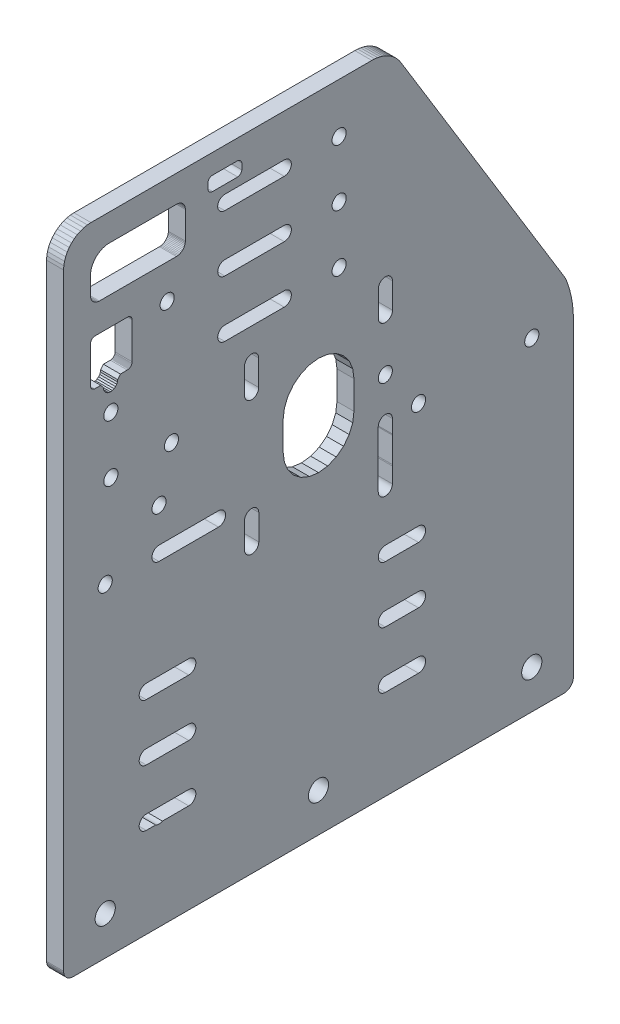
from build123d import *

# Parameters (mm, degrees)
SKETCH1_R           = 3.5685
SKETCH1_R_2         = 2.500000001
SKETCH1_R_3         = 2.5
BOSS_EXTRUDE1_DEPTH = 6
SKETCH2_R           = 2.500000001
SKETCH2_R_2         = 2.5
CUT_EXTRUDE3_DEPTH  = 1779.046328539


with BuildPart() as part:
    # Sketch1 → Boss-Extrude1 (new body)
    with BuildSketch(Plane(origin=(0, 0, 0), x_dir=(0, -1, 0), z_dir=(-1, 0, 0))):
        Polygon((-590.212112636, -1614.243728334), (-495.230350852, -1672.335619946), (-492.985489602, -1673.198794727), (-490.688058814, -1673.910331453), (-488.34828871, -1674.467061724), (-485.976598042, -1674.866506478), (-483.583547703, -1675.10688703), (-481.179793697, -1675.18713299), (-371.826596113, -1675.18713299), (-371.387664827, -1675.158363913), (-370.956243777, -1675.072548931), (-370.539714696, -1674.931156361), (-370.145204514, -1674.736605469), (-369.779463407, -1674.492225074), (-369.448749309, -1674.202196594), (-369.158720829, -1673.871482496), (-368.914340435, -1673.50574139), (-368.719789543, -1673.111231207), (-368.578396973, -1672.694702127), (-368.49258199, -1672.263281077), (-368.463812914, -1671.82434979), (-368.463812914, -1498.50991619), (-368.49258199, -1498.070984903), (-368.578396973, -1497.639563853), (-368.719789543, -1497.223034773), (-368.914340435, -1496.82852459), (-369.158720829, -1496.462783484), (-369.448749309, -1496.132069386), (-369.779463407, -1495.842040906), (-370.145204514, -1495.597660511), (-370.539714696, -1495.403109619), (-370.956243777, -1495.261717049), (-371.387664827, -1495.175902067), (-371.826596113, -1495.14713299), (-586.288106544, -1495.145619765), (-587.549717355, -1495.228301598), (-588.789742622, -1495.474950056), (-589.98696498, -1495.881344878), (-591.12089944, -1496.440532473), (-592.172143895, -1497.142944902), (-593.122711102, -1497.976563587), (-593.956336446, -1498.927124952), (-594.658756242, -1499.978364486), (-595.217951782, -1501.112295027), (-595.624354993, -1502.309514537), (-595.87101214, -1503.549538076), (-595.953702813, -1504.811148308), (-595.953702813, -1603.994310614), (-595.910202971, -1605.015955139), (-595.780018321, -1606.030204482), (-595.564091204, -1607.029716989), (-595.263984611, -1608.007257681), (-594.881870865, -1608.955750621), (-594.420515902, -1609.868330136), (-593.883259242, -1610.738390509), (-593.273989822, -1611.559633802), (-592.597117845, -1612.326115438), (-591.857542854, -1613.032287234), (-591.060618269, -1613.673037558), align=None)
        with Locations((-382.159118976, -1509.84713299)):
            Circle(SKETCH1_R, mode=Mode.SUBTRACT)
        with Locations((-382.159118976, -1585.16713299)):
            Circle(SKETCH1_R, mode=Mode.SUBTRACT)
        with Locations((-382.159118976, -1660.48713299)):
            Circle(SKETCH1_R, mode=Mode.SUBTRACT)
        with Locations((-538.399280751, -1592.457817223)):
            Circle(SKETCH1_R_2, mode=Mode.SUBTRACT)
        with Locations((-558.44846865, -1592.457817223)):
            Circle(SKETCH1_R_2, mode=Mode.SUBTRACT)
        with Locations((-578.44846865, -1592.457817223)):
            Circle(SKETCH1_R_2, mode=Mode.SUBTRACT)
        with Locations((-534.443559506, -1511.847133017)):
            Circle(SKETCH1_R_2, mode=Mode.SUBTRACT)
        with Locations((-558.402442437, -1531.722977175)):
            Circle(SKETCH1_R_2, mode=Mode.SUBTRACT)
        with Locations((-514.443559639, -1511.847132679)):
            Circle(SKETCH1_R_2, mode=Mode.SUBTRACT)
        with Locations((-514.443559639, -1533.238984755)):
            Circle(SKETCH1_R_2, mode=Mode.SUBTRACT)
        with Locations((-497.496167838, -1528.847132988)):
            Circle(SKETCH1_R_3, mode=Mode.SUBTRACT)
        with Locations((-482.799118976, -1549.84713299)):
            Circle(SKETCH1_R_2, mode=Mode.SUBTRACT)
        with Locations((-482.799118976, -1509.84713299)):
            Circle(SKETCH1_R_2, mode=Mode.SUBTRACT)
        with Locations((-482.799118976, -1620.48713299)):
            Circle(SKETCH1_R_2, mode=Mode.SUBTRACT)
        with Locations((-482.799118977, -1660.487132991)):
            Circle(SKETCH1_R_2, mode=Mode.SUBTRACT)
        with Locations((-402.49616799, -1528.847132989)):
            Circle(SKETCH1_R_2, mode=Mode.SUBTRACT)
        with BuildLine():
            Line((-575.977758464, -1552.084054241), (-575.977758464, -1573.056806032))
            ThreePointArc((-575.977758464, -1573.056806032), (-578.457148005, -1575.577342323), (-580.977684295, -1573.097952782))
            Line((-580.977684295, -1573.097952782), (-580.977684295, -1552.084054231))
            ThreePointArc((-580.977684295, -1552.084054231), (-578.477721375, -1549.570437307), (-575.977758464, -1552.084054241))
        make_face(mode=Mode.SUBTRACT)
        with BuildLine():
            Line((-535.977790671, -1552.085412401), (-535.977790671, -1573.058164192))
            ThreePointArc((-535.977790671, -1573.058164192), (-538.457180211, -1575.578700483), (-540.977716502, -1573.099310942))
            Line((-540.977716502, -1573.099310942), (-540.977716502, -1552.085412391))
            ThreePointArc((-540.977716502, -1552.085412391), (-538.477753581, -1549.571795467), (-535.977790671, -1552.085412401))
        make_face(mode=Mode.SUBTRACT)
        with BuildLine():
            Line((-555.97770846, -1552.099177314), (-555.97770846, -1573.085546029))
            ThreePointArc((-555.97770846, -1573.085546029), (-558.463906443, -1575.599273877), (-560.977634291, -1573.113075895))
            Line((-560.977634291, -1573.113075895), (-560.977634291, -1552.099177304))
            ThreePointArc((-560.977634291, -1552.099177304), (-558.47767137, -1549.58556036), (-555.97770846, -1552.099177314))
        make_face(mode=Mode.SUBTRACT)
        with BuildLine():
            Line((-524.913709892, -1559.055192962), (-515.913733671, -1559.055192962))
            ThreePointArc((-515.913733671, -1559.055192962), (-513.413733671, -1561.555192962), (-515.913733671, -1564.055192962))
            Line((-515.913733671, -1564.055192962), (-524.913709892, -1564.055192962))
            ThreePointArc((-524.913709892, -1564.055192962), (-527.413709892, -1561.555192962), (-524.913709892, -1559.055192962))
        make_face(mode=Mode.SUBTRACT)
        with BuildLine():
            Line((-524.913709892, -1606.299062763), (-515.913733671, -1606.299062763))
            ThreePointArc((-515.913733671, -1606.299062763), (-513.413733671, -1608.799062763), (-515.913733671, -1611.299062763))
            Line((-515.913733671, -1611.299062763), (-524.913709892, -1611.299062763))
            ThreePointArc((-524.913709892, -1611.299062763), (-527.413709892, -1608.799062763), (-524.913709892, -1606.299062763))
        make_face(mode=Mode.SUBTRACT)
        with BuildLine():
            Line((-477.66984009, -1606.299062763), (-468.669863869, -1606.299062763))
            ThreePointArc((-468.669863869, -1606.299062763), (-466.169863869, -1608.799062763), (-468.669863869, -1611.299062763))
            Line((-468.669863869, -1611.299062763), (-477.66984009, -1611.299062763))
            ThreePointArc((-477.66984009, -1611.299062763), (-480.16984009, -1608.799062763), (-477.66984009, -1606.299062763))
        make_face(mode=Mode.SUBTRACT)
        with BuildLine():
            Line((-477.669839463, -1559.052819647), (-468.669863869, -1559.055192962))
            ThreePointArc((-468.669863869, -1559.055192962), (-466.159015015, -1561.567366398), (-468.671188452, -1564.078215252))
            Line((-468.671188452, -1564.078215252), (-477.669845536, -1564.075842286))
            ThreePointArc((-477.669845536, -1564.075842286), (-480.18069465, -1561.564327931), (-477.669839463, -1559.052819647))
        make_face(mode=Mode.SUBTRACT)
        Polygon((-586.033555203, -1536.579108211), (-586.214987166, -1536.211200586), (-586.346845371, -1535.822758839), (-586.426873689, -1535.420429315), (-586.453702813, -1535.011095984), (-586.453702813, -1511.296236305), (-586.396818705, -1510.428352529), (-586.227139684, -1509.575318486), (-585.947569005, -1508.751729823), (-585.5628902, -1507.971678372), (-585.079685229, -1507.248511028), (-584.506221865, -1506.594601387), (-583.852312223, -1506.021138022), (-583.12914488, -1505.537933052), (-582.349093428, -1505.153254247), (-581.525504766, -1504.873683568), (-580.672470722, -1504.704004546), (-579.804586946, -1504.647120438), (-573.616888973, -1504.647120438), (-573.207555642, -1504.673949562), (-572.805226118, -1504.75397788), (-572.416784371, -1504.885836086), (-572.048876746, -1505.067268048), (-571.707798245, -1505.295169417), (-571.399384815, -1505.565640735), (-571.128913497, -1505.874054164), (-570.901012129, -1506.215132665), (-570.719580166, -1506.58304029), (-570.587721961, -1506.971482038), (-570.507693643, -1507.373811562), (-570.480864519, -1507.783144892), (-570.480864519, -1535.011095984), (-570.507693643, -1535.420429315), (-570.587721961, -1535.822758839), (-570.719580166, -1536.211200586), (-570.901012129, -1536.579108211), (-571.128913497, -1536.920186712), (-571.399384815, -1537.228600142), (-571.707798245, -1537.49907146), (-572.048876746, -1537.726972829), (-572.416784371, -1537.908404791), (-572.805226118, -1538.040262996), (-573.207555642, -1538.120291315), (-573.616888973, -1538.147120438), (-583.317678359, -1538.147120438), (-583.72701169, -1538.120291315), (-584.129341214, -1538.040262996), (-584.517782961, -1537.908404791), (-584.885690586, -1537.726972828), (-585.226769087, -1537.49907146), (-585.535182516, -1537.228600142), (-585.805653835, -1536.920186712), align=None, mode=Mode.SUBTRACT)
        Polygon((-560.539732338, -1505.878268758), (-560.469558584, -1505.671543545), (-560.373002121, -1505.475746407), (-560.251715057, -1505.294227488), (-560.107772647, -1505.130092628), (-559.943637786, -1504.986150218), (-559.762118868, -1504.864863154), (-559.56632173, -1504.768306692), (-559.359596516, -1504.698132937), (-559.131202133, -1504.647120439), (-558.927636825, -1504.641264366), (-548.4808636, -1504.645157132), (-545.881846575, -1504.645157132), (-545.667730411, -1504.687747485), (-545.461005198, -1504.757921239), (-545.26520806, -1504.854477702), (-545.083689141, -1504.975764766), (-544.919554281, -1505.119707176), (-544.775611871, -1505.283842037), (-544.654324807, -1505.465360956), (-544.557768344, -1505.661158094), (-544.48759459, -1505.867883307), (-544.445004238, -1506.081999471), (-544.441434684, -1508.267709423), (-543.221041992, -1509.237688263), (-542.573960137, -1509.322613597), (-541.970907354, -1509.572122279), (-541.452980696, -1509.969210703), (-541.055476008, -1510.486817951), (-540.805482577, -1511.089669943), (-540.720037042, -1511.736683313), (-540.804962376, -1512.383765169), (-541.054471058, -1512.986817951), (-541.451559482, -1513.504744609), (-541.96916673, -1513.902249297), (-542.572018722, -1514.152242729), (-543.219032092, -1514.237688263), (-544.432285676, -1515.207667102), (-544.430726027, -1517.677645941), (-544.487594599, -1518.109605632), (-544.557768353, -1518.316330846), (-544.654324816, -1518.512127983), (-544.77561188, -1518.693646902), (-544.91955429, -1518.857781763), (-545.083689151, -1519.001724172), (-545.26520807, -1519.123011236), (-545.461005208, -1519.219567699), (-545.667730421, -1519.289741453), (-546.099691027, -1519.348570172), (-558.957839921, -1519.342717258), (-559.145480362, -1519.342717258), (-559.359596526, -1519.300126905), (-559.566321739, -1519.229953151), (-559.762118877, -1519.133396688), (-559.943637796, -1519.012109624), (-560.107772656, -1518.868167214), (-560.251715066, -1518.704032353), (-560.37300213, -1518.522513435), (-560.469558592, -1518.326716297), (-560.539732347, -1518.119991083), (-560.582322699, -1517.905874919), (-560.582322699, -1517.679609247), (-560.568044472, -1506.083962777), align=None, mode=Mode.SUBTRACT)
        Polygon((-512.609294248, -1578.937135138), (-510.622811466, -1576.348300373), (-508.033976701, -1574.36181759), (-505.019214764, -1573.113062308), (-501.7839767, -1572.687135137), (-491.783976402, -1572.687135137), (-488.548738338, -1573.113062308), (-485.533976401, -1574.36181759), (-482.945141636, -1576.348300373), (-480.958658854, -1578.937135138), (-479.709903572, -1581.951897074), (-479.283976401, -1585.187135138), (-479.709903572, -1588.422373202), (-480.958658854, -1591.437135139), (-482.945141636, -1594.025969904), (-485.533976401, -1596.012452687), (-488.548738338, -1597.261207968), (-491.783976402, -1597.68713514), (-501.7839767, -1597.68713514), (-505.019214764, -1597.261207968), (-508.033976701, -1596.012452687), (-510.622811466, -1594.025969904), (-512.609294248, -1591.437135139), (-513.85804953, -1588.422373202), (-514.283976701, -1585.187135138), (-513.85804953, -1581.951897074), align=None, mode=Mode.SUBTRACT)
        with BuildLine():
            Line((-588.98086362, -1556.648178727), (-588.98086362, -1547.550419842))
            ThreePointArc((-588.98086362, -1547.550419842), (-588.50376059, -1546.590680791), (-587.544021697, -1546.113577446))
            Line((-587.544021697, -1546.113577446), (-585.643575513, -1546.099299227))
            ThreePointArc((-585.643575513, -1546.099299227), (-584.463439705, -1546.588127429), (-583.974611428, -1547.768263206))
            Line((-583.974611428, -1547.768263206), (-583.988889647, -1556.648178564))
            ThreePointArc((-583.988889647, -1556.648178564), (-584.465992569, -1557.607917612), (-585.425731394, -1558.085020984))
            Line((-585.425731394, -1558.085020984), (-587.544021696, -1558.085020984))
            ThreePointArc((-587.544021696, -1558.085020984), (-588.506313615, -1557.610470755), (-588.98086362, -1556.648178727))
        make_face(mode=Mode.SUBTRACT)
    extrude(amount=-BOSS_EXTRUDE1_DEPTH)

    # Sketch2 → Cut-Extrude3 (cut, through all)
    with BuildSketch(Plane(origin=(6, 0, 0), x_dir=(0, 0, -1), z_dir=(1, 0, 0))):
        with BuildLine():
            Line((1611.267132991, 462.799118976), (1611.267132991, 482.799118976))
            ThreePointArc((1611.267132991, 482.799118976), (1608.76713299, 485.299118977), (1606.267132989, 482.799118976))
            Line((1606.267132989, 482.799118976), (1606.267132989, 462.799118976))
            ThreePointArc((1606.267132989, 462.799118976), (1608.76713299, 460.299118975), (1611.267132991, 462.799118976))
        make_face()
        with BuildLine():
            Line((1608.76713299, 440.299118976), (1620.48713299, 440.299118976))
            ThreePointArc((1620.48713299, 440.299118976), (1622.98713299, 442.799118976), (1620.48713299, 445.299118976))
            Line((1620.48713299, 445.299118976), (1608.76713299, 445.299118976))
            ThreePointArc((1608.76713299, 445.299118976), (1606.26713299, 442.799118976), (1608.76713299, 440.299118976))
        make_face()
        with BuildLine():
            Line((1608.76713299, 420.299118976), (1620.48713299, 420.299118976))
            ThreePointArc((1620.48713299, 420.299118976), (1622.98713299, 422.799118976), (1620.48713299, 425.299118976))
            Line((1620.48713299, 425.299118976), (1608.76713299, 425.299118976))
            ThreePointArc((1608.76713299, 425.299118976), (1606.26713299, 422.799118976), (1608.76713299, 420.299118976))
        make_face()
        with BuildLine():
            Line((1608.76713299, 400.299118976), (1620.48713299, 400.299118976))
            ThreePointArc((1620.48713299, 400.299118976), (1622.98713299, 402.799118976), (1620.48713299, 405.299118976))
            Line((1620.48713299, 405.299118976), (1608.76713299, 405.299118976))
            ThreePointArc((1608.76713299, 405.299118976), (1606.26713299, 402.799118976), (1608.76713299, 400.299118976))
        make_face()
        with BuildLine():
            Line((1524.347132989, 440.299118976), (1539.347132989, 440.299118976))
            ThreePointArc((1539.347132989, 440.299118976), (1541.847132989, 442.799118976), (1539.347132989, 445.299118976))
            Line((1539.347132989, 445.299118976), (1524.347132989, 445.299118976))
            ThreePointArc((1524.347132989, 445.299118976), (1521.847132989, 442.799118976), (1524.347132989, 440.299118976))
        make_face()
        with BuildLine():
            Line((1528.847484314, 480.296167863), (1549.847484316, 480.299119001))
            ThreePointArc((1549.847484316, 480.299119001), (1552.347132966, 482.799470302), (1549.846781664, 485.299118951))
            Line((1549.846781664, 485.299118951), (1528.846781662, 485.296167813))
            ThreePointArc((1528.846781662, 485.296167813), (1526.347133012, 482.795816512), (1528.847484314, 480.296167863))
        make_face()
        with BuildLine():
            Line((1524.347274108, 420.299118976), (1539.347274108, 420.299118976))
            ThreePointArc((1539.347274108, 420.299118976), (1541.847274108, 422.799118976), (1539.347274108, 425.299118976))
            Line((1539.347274108, 425.299118976), (1524.347274108, 425.299118976))
            ThreePointArc((1524.347274108, 425.299118976), (1521.847274108, 422.799118976), (1524.347274108, 420.299118976))
        make_face()
        with BuildLine():
            Line((1524.347415226, 400.299118977), (1539.347415226, 400.299118977))
            ThreePointArc((1539.347415226, 400.299118977), (1541.847415226, 402.799118977), (1539.347415226, 405.299118977))
            Line((1539.347415226, 405.299118977), (1524.347415226, 405.299118977))
            ThreePointArc((1524.347415226, 405.299118977), (1521.847415226, 402.799118977), (1524.347415226, 400.299118977))
        make_face()
        with Locations((1620.48713299, 482.799118976)):
            Circle(SKETCH2_R)
        with Locations((1608.767132988, 497.496167838)):
            Circle(SKETCH2_R_2)
    extrude(amount=-CUT_EXTRUDE3_DEPTH, mode=Mode.SUBTRACT)


solid = part.part
